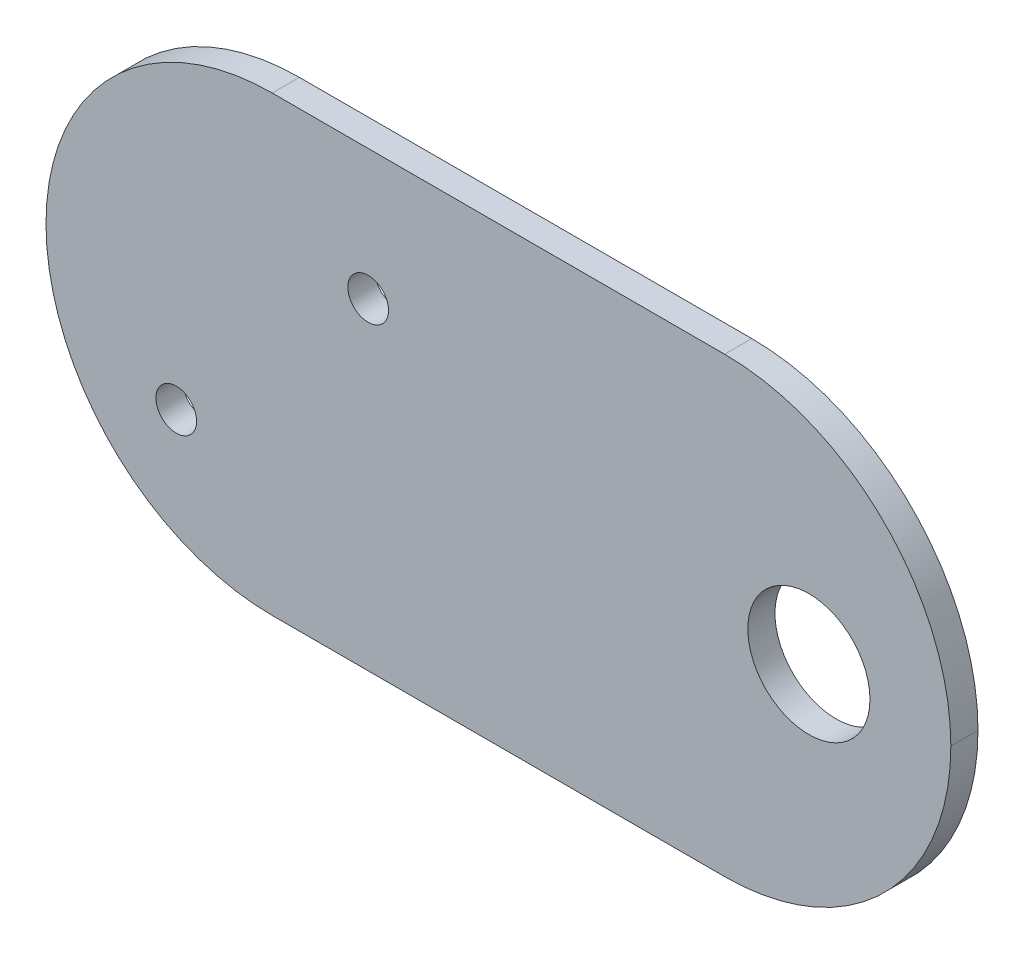
from build123d import *

# Parameters (mm, degrees)
SKETCH1_W           = 100
SKETCH1_H           = 50
BOSS_EXTRUDE1_DEPTH = 3
SKETCH2_R           = 6.75
SKETCH2_R_2         = 2.25
CUT_EXTRUDE1_DEPTH  = 56.982140009
FILLET1_R           = 25


with BuildPart() as part:
    # Sketch1 → Boss-Extrude1 (new body)
    with BuildSketch(Plane.XY):
        Rectangle(SKETCH1_W, SKETCH1_H)
    extrude(amount=BOSS_EXTRUDE1_DEPTH)

    # Sketch2 → Cut-Extrude1 (cut, through all)
    with BuildSketch(Plane.XY.offset(3)):
        with Locations((34.310453011, 0)):
            Circle(SKETCH2_R)
        with Locations((-14.393398282, 10.606601718)):
            Circle(SKETCH2_R_2)
        with Locations((-35.606601718, -10.606601718)):
            Circle(SKETCH2_R_2)
    extrude(amount=-CUT_EXTRUDE1_DEPTH, mode=Mode.SUBTRACT)

    # Fillet1
    fillet1_edges = [part.edges().sort_by_distance(p)[0] for p in [
        (-50, -25, 1.5),
        (-50, 25, 1.5),
        (50, 25, 1.5),
        (50, -25, 1.5),
    ]]
    fillet(fillet1_edges, radius=FILLET1_R - 0.0001)  # a hair under: the kernel refuses the full size


solid = part.part
